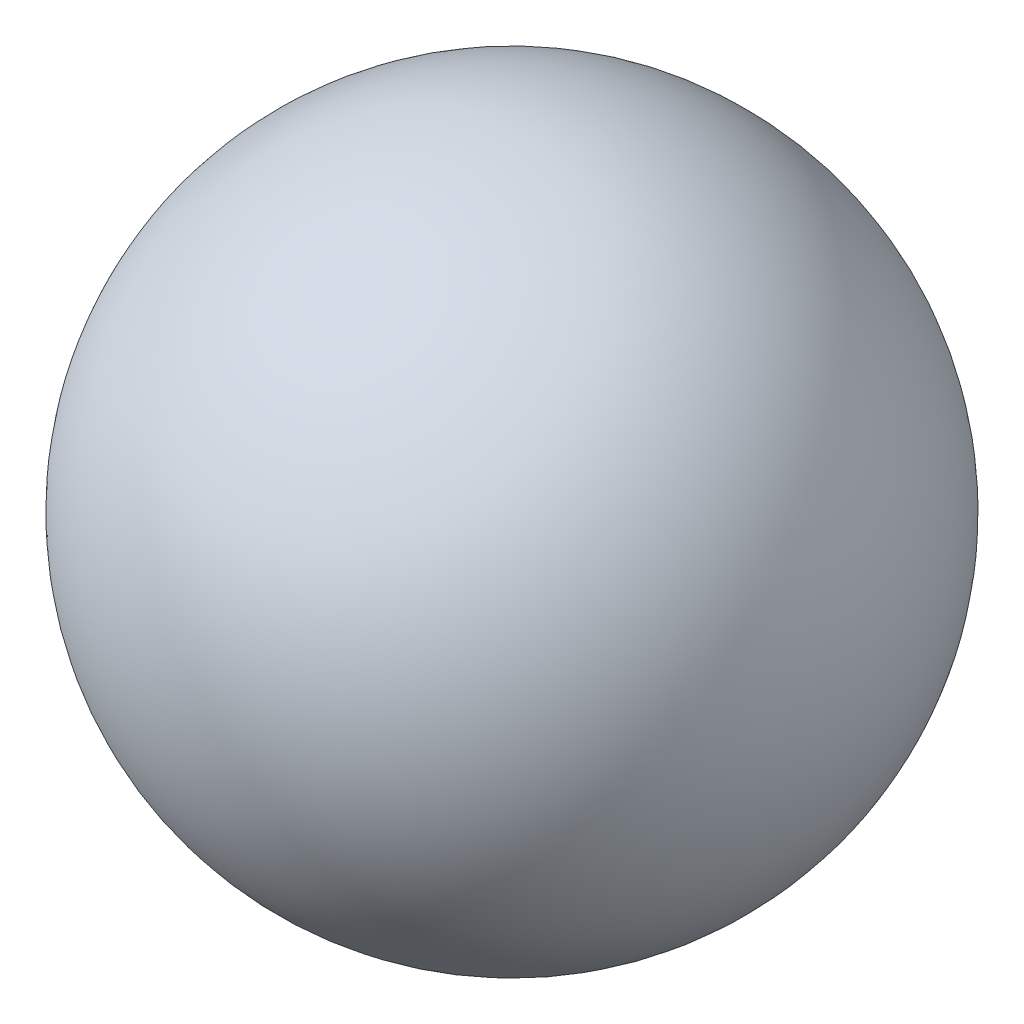
from build123d import *
from build123d.topology import SkipClean


with BuildPart() as part:
    # Sketch1 → Revolve1 (revolve)
    with SkipClean():  # the faces are left unmerged after this step: merging them gives an invalid solid
        with BuildSketch(Plane.XY):
            with BuildLine():
                ThreePointArc((7.95, 0), (0, 7.95), (-7.95, 0))
                Line((-7.95, 0), (7.95, 0))
            make_face()
            with BuildLine():
                Line((7.95, 0), (-7.95, 0))
                ThreePointArc((-7.95, 0), (0, -7.95), (7.95, 0))
            make_face()
        revolve(axis=Axis((-7.95, 0, 0), (1, 0, 0)))
    add(part.part.scale(1), mode=Mode.REPLACE)  # the faces are merged on a copy


solid = part.part
